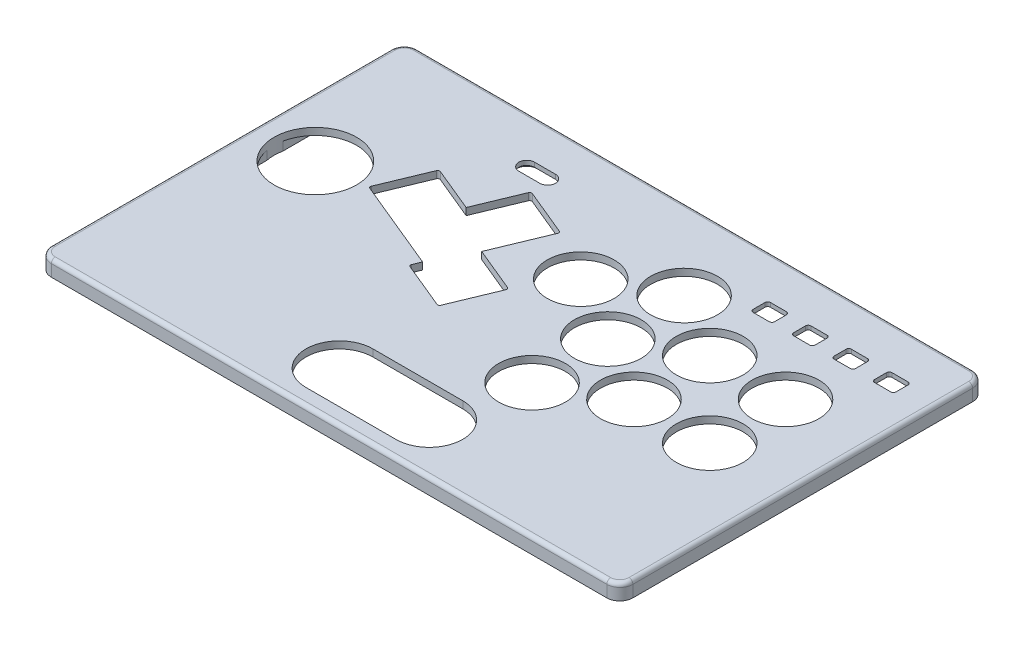
from build123d import *

# Parameters (mm, degrees)
SKETCH1_W                           = 222.53
SKETCH1_H                           = 140
TOP_PLATE_DEPTH                     = 6
CORNER_FILLET_R                     = 5
TOP_FILLET_R                        = 1.5
M3_CLEARANCE_HOLE1_D                = 3.4
M3_CLEARANCE_HOLE1_DEPTH            = 4.228536948
M3_CLEARANCE_HOLE1_TIP              = 1.021463052
SKETCH4_R                           = 15.8
SKETCH4_R_2                         = 12.8
PRIMARY_BUTTONS_DEPTH               = 10
EXTRA_BUTTONS_REACH                 = 264.975
SKETCH8_W                           = 207.53
SKETCH8_H                           = 125
HOLLOW_OUT_DEPTH                    = 3.3
FILLET1_R                           = 10
FILLET2_R                           = 5
SKETCH6_W                           = 62.5
SKETCH6_H                           = 16
EXTRA_BUTTON_KEYSWITCH_RELIEF_DEPTH = 1.1
LIGHT_GUIDE_CUTOUT_DEPTH            = 10
CHAMFER1_SIZE                       = 1
BOSS_EXTRUDE1_START                 = 4
BOSS_EXTRUDE1_DEPTH                 = 12


with BuildPart() as part:
    # Sketch1 → Top Plate (new body)
    with BuildSketch(Plane(origin=(0, 0, 0), x_dir=(1, 0, 0), z_dir=(0, 1, 0))):
        with Locations((111.265, 70)):
            Rectangle(SKETCH1_W, SKETCH1_H)
    extrude(amount=TOP_PLATE_DEPTH)

    # Corner Fillet
    corner_fillet_edges = [part.edges().sort_by_distance(p)[0] for p in [
        (0, 3, -140),
        (0, 3, 0),
        (222.53, 3, -140),
        (222.53, 3, 0),
    ]]
    fillet(corner_fillet_edges, radius=CORNER_FILLET_R)

    # Top Fillet
    top_fillet_edges = [part.edges().sort_by_distance(p)[0] for p in [
        (1.464466094, 6, -1.464466094),
        (0, 6, -70),
        (1.464466094, 6, -138.535533906),
        (111.265, 6, -140),
        (221.065533906, 6, -138.535533906),
        (222.53, 6, -70),
        (221.065533906, 6, -1.464466094),
        (111.265, 6, 0),
    ]]
    fillet(top_fillet_edges, radius=TOP_FILLET_R)

    # M3 Clearance Hole1
    with Locations(Plane(origin=(217.03, 0, -5.5), x_dir=(0, 0, -1), z_dir=(0, -1, 0))):
        with Locations((0, 0), (129, 0), (129, -211.53), (0, -211.53)):
            Hole(M3_CLEARANCE_HOLE1_D / 2, depth=M3_CLEARANCE_HOLE1_DEPTH)
            with Locations((0, 0, -(M3_CLEARANCE_HOLE1_DEPTH + M3_CLEARANCE_HOLE1_TIP / 2))):  # 118° drill point
                Cone(0, M3_CLEARANCE_HOLE1_D / 2, M3_CLEARANCE_HOLE1_TIP, mode=Mode.SUBTRACT)

    # Sketch4 → Primary Buttons (cut)
    with BuildSketch(Plane(origin=(0, 6, 0), x_dir=(-1, 0, 0), z_dir=(0, -1, 0))):
        with BuildLine():
            Line((-76.944414512, 70.107669008), (-42.483708291, 84.381760493))
            ThreePointArc((-42.483708291, 84.381760493), (-42.050751411, 84.814717373), (-42.050751411, 85.427010865))
            Line((-42.050751411, 85.427010865), (-49.340870797, 103.026915959))
            ThreePointArc((-49.340870797, 103.026915959), (-49.773827677, 103.459872839), (-50.386121169, 103.459872839))
            Line((-50.386121169, 103.459872839), (-67.246922267, 96.475900352))
            Line((-67.246922267, 96.475900352), (-74.230894335, 113.336702236))
            ThreePointArc((-74.230894335, 113.336702236), (-74.663851213, 113.769659138), (-75.276144719, 113.769659144))
            Line((-75.276144719, 113.769659144), (-92.876049813, 106.479539758))
            ThreePointArc((-92.876049813, 106.479539758), (-93.30900669, 106.046582884), (-93.309006699, 105.434289399))
            Line((-93.309006699, 105.434289399), (-86.018887558, 87.834383992))
            Line((-86.018887558, 87.834383992), (-84.794300458, 84.877969205))
            Line((-84.794300458, 84.877969205), (-101.655101987, 77.893996539))
            ThreePointArc((-101.655101987, 77.893996539), (-102.088058868, 77.461039658), (-102.088058868, 76.848746167))
            Line((-102.088058868, 76.848746167), (-94.797939481, 59.248841072))
            ThreePointArc((-94.797939481, 59.248841072), (-94.364982601, 58.815884192), (-93.752689109, 58.815884192))
            Line((-93.752689109, 58.815884192), (-76.152784155, 66.106003521))
            ThreePointArc((-76.152784155, 66.106003521), (-75.719827275, 66.538960401), (-75.719827275, 67.151253892))
            Line((-75.719827275, 67.151253892), (-76.944414512, 70.107669008))
        make_face()
        with BuildLine():
            Line((-96.24, 31.79), (-130.64, 31.79))
            ThreePointArc((-130.64, 31.79), (-143.44, 18.99), (-130.64, 6.19))
            Line((-130.64, 6.19), (-96.24, 6.19))
            ThreePointArc((-96.24, 6.19), (-83.44, 18.99), (-96.24, 31.79))
        make_face()
        with Locations((-23, 83.008304)):
            Circle(SKETCH4_R)
        with Locations((-137.933943, 51)):
            Circle(SKETCH4_R_2)
        with Locations((-162.933943, 65)):
            Circle(SKETCH4_R_2)
        with Locations((-191.933943, 65)):
            Circle(SKETCH4_R_2)
        with Locations((-191.933943, 94)):
            Circle(SKETCH4_R_2)
        with Locations((-162.933943, 94)):
            Circle(SKETCH4_R_2)
        with Locations((-137.933943, 80)):
            Circle(SKETCH4_R_2)
        with Locations((-138.114257, 108.999439)):
            Circle(SKETCH4_R_2)
        with Locations((-112.915906, 94.645876)):
            Circle(SKETCH4_R_2)
    extrude(amount=PRIMARY_BUTTONS_DEPTH, mode=Mode.SUBTRACT)

    # Sketch5 → Extra Buttons (cut, up to next)
    with BuildSketch(Plane.XZ, mode=Mode.PRIVATE) as extra_buttons_sk1:
        with BuildLine():
            Line((155.9, -122.22), (155.9, -117.62))
            ThreePointArc((155.9, -117.62), (156.192893219, -116.912893219), (156.9, -116.62))
            Line((156.9, -116.62), (163.1, -116.62))
            ThreePointArc((163.1, -116.62), (163.807106781, -116.912893219), (164.1, -117.62))
            Line((164.1, -117.62), (164.1, -122.22))
            ThreePointArc((164.1, -122.22), (163.807106781, -122.927106781), (163.1, -123.22))
            Line((163.1, -123.22), (156.9, -123.22))
            ThreePointArc((156.9, -123.22), (156.192893219, -122.927106781), (155.9, -122.22))
        make_face()
    extra_buttons_tool1 = extrude(extra_buttons_sk1.sketch, amount=-EXTRA_BUTTONS_REACH, mode=Mode.PRIVATE) & part.part
    # Sketch5 → Extra Buttons (cut, up to next)
    with BuildSketch(Plane.XZ, mode=Mode.PRIVATE) as extra_buttons_sk2:
        with BuildLine():
            Line((171.4, -122.22), (171.4, -117.62))
            ThreePointArc((171.4, -117.62), (171.692893219, -116.912893219), (172.4, -116.62))
            Line((172.4, -116.62), (178.6, -116.62))
            ThreePointArc((178.6, -116.62), (179.307106781, -116.912893219), (179.6, -117.62))
            Line((179.6, -117.62), (179.6, -122.22))
            ThreePointArc((179.6, -122.22), (179.307106781, -122.927106781), (178.6, -123.22))
            Line((178.6, -123.22), (172.4, -123.22))
            ThreePointArc((172.4, -123.22), (171.692893219, -122.927106781), (171.4, -122.22))
        make_face()
    extra_buttons_tool2 = extrude(extra_buttons_sk2.sketch, amount=-EXTRA_BUTTONS_REACH, mode=Mode.PRIVATE) & part.part
    # Sketch5 → Extra Buttons (cut, up to next)
    with BuildSketch(Plane.XZ, mode=Mode.PRIVATE) as extra_buttons_sk3:
        with BuildLine():
            Line((186.9, -122.22), (186.9, -117.62))
            ThreePointArc((186.9, -117.62), (187.192893219, -116.912893219), (187.9, -116.62))
            Line((187.9, -116.62), (194.1, -116.62))
            ThreePointArc((194.1, -116.62), (194.807106781, -116.912893219), (195.1, -117.62))
            Line((195.1, -117.62), (195.1, -122.22))
            ThreePointArc((195.1, -122.22), (194.807106781, -122.927106781), (194.1, -123.22))
            Line((194.1, -123.22), (187.9, -123.22))
            ThreePointArc((187.9, -123.22), (187.192893219, -122.927106781), (186.9, -122.22))
        make_face()
    extra_buttons_tool3 = extrude(extra_buttons_sk3.sketch, amount=-EXTRA_BUTTONS_REACH, mode=Mode.PRIVATE) & part.part
    # Sketch5 → Extra Buttons (cut, up to next)
    with BuildSketch(Plane.XZ, mode=Mode.PRIVATE) as extra_buttons_sk4:
        with BuildLine():
            Line((202.4, -122.22), (202.4, -117.62))
            ThreePointArc((202.4, -117.62), (202.692893219, -116.912893219), (203.4, -116.62))
            Line((203.4, -116.62), (209.6, -116.62))
            ThreePointArc((209.6, -116.62), (210.307106781, -116.912893219), (210.6, -117.62))
            Line((210.6, -117.62), (210.6, -122.22))
            ThreePointArc((210.6, -122.22), (210.307106781, -122.927106781), (209.6, -123.22))
            Line((209.6, -123.22), (203.4, -123.22))
            ThreePointArc((203.4, -123.22), (202.692893219, -122.927106781), (202.4, -122.22))
        make_face()
    extra_buttons_tool4 = extrude(extra_buttons_sk4.sketch, amount=-EXTRA_BUTTONS_REACH, mode=Mode.PRIVATE) & part.part
    add(extra_buttons_tool1.solids().sort_by_distance((160, 0, -119.92))[0], mode=Mode.SUBTRACT)
    add(extra_buttons_tool2.solids().sort_by_distance((175.5, 0, -119.92))[0], mode=Mode.SUBTRACT)
    add(extra_buttons_tool3.solids().sort_by_distance((191, 0, -119.92))[0], mode=Mode.SUBTRACT)
    add(extra_buttons_tool4.solids().sort_by_distance((206.5, 0, -119.92))[0], mode=Mode.SUBTRACT)

    # Sketch8 → Hollow Out (cut)
    with BuildSketch(Plane.XZ):
        with Locations((111.265, -70)):
            Rectangle(SKETCH8_W, SKETCH8_H)
    extrude(amount=-HOLLOW_OUT_DEPTH, mode=Mode.SUBTRACT)

    # Fillet1
    fillet1_edges = [part.edges().sort_by_distance(p)[0] for p in [
        (7.5, 1.65, -132.5),
        (7.5, 1.65, -7.5),
        (215.03, 1.65, -7.5),
    ]]
    fillet(fillet1_edges, radius=FILLET1_R)

    # Fillet2
    fillet2_edges = [part.edges().sort_by_distance(p)[0] for p in [
        (215.03, 1.65, -132.5),
    ]]
    fillet(fillet2_edges, radius=FILLET2_R)

    # Sketch6 → Extra Button Keyswitch Relief (cut)
    with BuildSketch(Plane.XZ.offset(-3.3)):
        with Locations((183.25, -119.92)):
            Rectangle(SKETCH6_W, SKETCH6_H)
    extrude(amount=-EXTRA_BUTTON_KEYSWITCH_RELIEF_DEPTH, mode=Mode.SUBTRACT)

    # Sketch9 → Light Guide Cutout (cut)
    with BuildSketch(Plane(origin=(0, 6, 0), x_dir=(1, 0, 0), z_dir=(0, 1, 0))):
        with BuildLine():
            Line((65.305, 124.5875), (73.305, 124.5875))
            ThreePointArc((73.305, 124.5875), (76.305, 121.5875), (73.305, 118.5875))
            Line((73.305, 118.5875), (65.305, 118.5875))
            ThreePointArc((65.305, 118.5875), (62.305, 121.5875), (65.305, 124.5875))
        make_face()
    extrude(amount=-LIGHT_GUIDE_CUTOUT_DEPTH, mode=Mode.SUBTRACT)

    # Chamfer1
    chamfer1_edges = [part.edges().sort_by_distance(p)[0] for p in [
        (76.305, 3.3, -121.5875),
        (69.305, 3.3, -118.5875),
        (62.305, 3.3, -121.5875),
        (69.305, 3.3, -124.5875),
    ]]
    chamfer(chamfer1_edges, length=CHAMFER1_SIZE)

    # Sketch10 → Boss-Extrude1 (add)
    with BuildSketch(Plane.ZY.offset(-49.38).offset(BOSS_EXTRUDE1_START)):
        Polygon((-132.5, 0), (-132.5, 3.3), (-127.5, 3.3), (-122.5, 3.3), (-122.5, -6.2), (-127.5, -6.2), (-127.5, -3.2), align=None)
    extrude(amount=BOSS_EXTRUDE1_DEPTH)


solid = part.part
